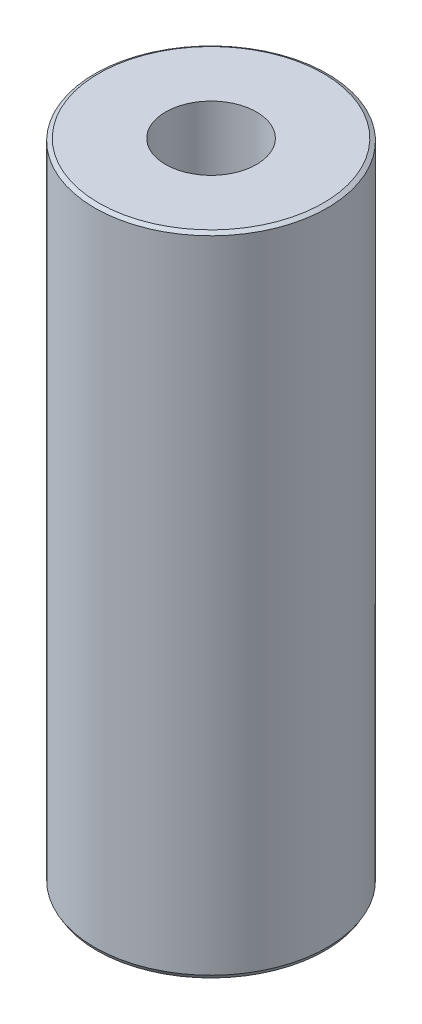
from build123d import *
from OCP.BRepFilletAPI import BRepFilletAPI_MakeChamfer

# Parameters (mm, degrees)
SKETCH1_R           = 47.5
BOSS_EXTRUDE1_DEPTH = 264.178328498
SKETCH2_R           = 18.595008918
CUT_EXTRUDE1_DEPTH  = 273.585196311
CHAMFER1_SIZE       = 0.94207601
CHAMFER1_SIZE2      = 1.631723514


with BuildPart() as part:
    # Sketch1 → Boss-Extrude1 (new body)
    with BuildSketch(Plane(origin=(0, 0, 0), x_dir=(1, 0, 0), z_dir=(0, 1, 0))):
        Circle(SKETCH1_R)
    extrude(amount=BOSS_EXTRUDE1_DEPTH)

    # Sketch2 → Cut-Extrude1 (cut, through all)
    with BuildSketch(Plane(origin=(0, 0, 0), x_dir=(1, 0, 0), z_dir=(0, 1, 0))):
        Circle(SKETCH2_R)
    extrude(amount=CUT_EXTRUDE1_DEPTH, mode=Mode.SUBTRACT)

    # Chamfer1: one chamfer whose edges measure the first distance from different faces: ONE call of the kernel's chamfer builder (chamfer() names one face for all edges)
    chamfer1_edges_1 = [part.edges().sort_by_distance(p)[0] for p in [
        (-47.5, 264.178328498, 0),
    ]]
    chamfer1_side_1 = [part.faces().sort_by_distance(p)[0] for p in [
        (-47.5, 132.089164249, 0),
    ]]
    chamfer1_edges_2 = [part.edges().sort_by_distance(p)[0] for p in [
        (-47.5, 0, 0),
    ]]
    chamfer1_side_2 = [part.faces().sort_by_distance(p)[0] for p in [
        (-46.156497116, 0, 0),
    ]]
    chamfer1 = BRepFilletAPI_MakeChamfer(part.part.solid().wrapped)
    for e in chamfer1_edges_1:
        chamfer1.Add(CHAMFER1_SIZE, CHAMFER1_SIZE2, e.wrapped, chamfer1_side_1[0].wrapped)  # the first distance lies on this face
    for e in chamfer1_edges_2:
        chamfer1.Add(CHAMFER1_SIZE, CHAMFER1_SIZE2, e.wrapped, chamfer1_side_2[0].wrapped)  # the first distance lies on this face
    add(Compound.cast(chamfer1.Shape()), mode=Mode.REPLACE)


solid = part.part
